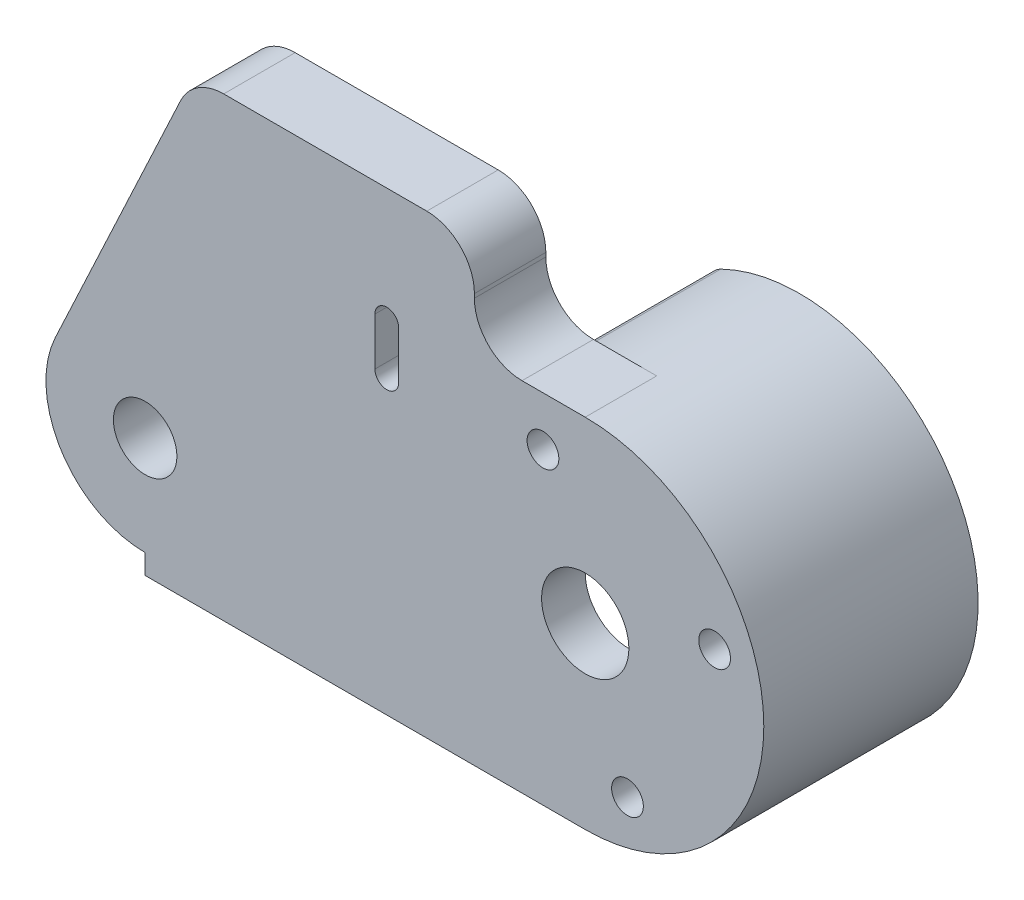
from build123d import *

# Parameters (mm, degrees)
SKETCH1_R               = 2
SKETCH1_R_2             = 5.5
SKETCH1_R_3             = 4
BOSS_EXTRUDE1_DEPTH     = 9
BOSS_EXTRUDE2_START     = -27
BOSS_EXTRUDE2_OUTLINE_R = 2
BOSS_EXTRUDE2_DEPTH     = 18
FILLET1_R               = 4
FILLET2_R               = 3
SKETCH3_R               = 11.25
CUT_EXTRUDE1_DEPTH      = 3.5
BOSS_EXTRUDE3_START     = -9
BOSS_EXTRUDE3_DEPTH     = 9
CUT_EXTRUDE2_DEPTH      = 93.793746104
CUT_EXTRUDE2_DEPTH_BACK = 93.793746104
SKETCH7_W               = 7.5
SKETCH7_H               = 5
CUT_EXTRUDE3_DEPTH      = 8.25
SKETCH8_R               = 2
CUT_EXTRUDE5_DEPTH      = 8.25
FILLET4_R               = 6


# Read off the part's stored shape, not the designer's step: Boss-Extrude2
with BuildPart() as part:
    # Sketch1 → Boss-Extrude1 (new body)
    with BuildSketch(Plane.XY):
        with BuildLine():
            Line((0, -15), (55.445040355, -15))
            ThreePointArc((55.445040355, -15), (77.945040355, 7.5), (55.445040355, 30))
            Line((55.445040355, 30), (12.958080577, 30))
            ThreePointArc((12.958080577, 30), (2.222427952, 26.874411477), (-5.157701411, 18.474576271))
            Line((-5.157701411, 18.474576271), (-11.322363742, 5.296610169))
            ThreePointArc((-11.322363742, 5.296610169), (-10.546507173, -6.709782891), (0, -12.5))
            Line((0, -12.5), (0, -15))
        make_face()
        with Locations((50.121730514, 23.802909935)):
            Circle(SKETCH1_R, mode=Mode.SUBTRACT)
        with Locations((60.768350196, -8.802909935)):
            Circle(SKETCH1_R, mode=Mode.SUBTRACT)
        with Locations((55.445040355, 7.5)):
            Circle(SKETCH1_R_2, mode=Mode.SUBTRACT)
        with Locations((71.74795029, 12.823309841)):
            Circle(SKETCH1_R, mode=Mode.SUBTRACT)
        Circle(SKETCH1_R_3, mode=Mode.SUBTRACT)
    extrude(amount=BOSS_EXTRUDE1_DEPTH)

    # Boss-Extrude2 outline → Boss-Extrude2 (add)
    with BuildSketch(Plane.XY.offset(9).offset(BOSS_EXTRUDE2_START)):
        with BuildLine():
            ThreePointArc((55.445040355, -15), (76.903671747, 14.265880489), (42.539570537, 25.930920997))
            Line((42.539570537, 25.930920997), (47.701758465, 18.558552598))
            ThreePointArc((47.701758465, 18.558552598), (68.32021919, 11.559528293), (55.445040355, -6))
            Line((55.445040355, -6), (55.445040355, -15))
        make_face()
        with Locations((60.768350196, -8.802909935)):
            Circle(BOSS_EXTRUDE2_OUTLINE_R, mode=Mode.SUBTRACT)
        with Locations((50.121730514, 23.802909935)):
            Circle(BOSS_EXTRUDE2_OUTLINE_R, mode=Mode.SUBTRACT)
        with Locations((71.74795029, 12.823309841)):
            Circle(BOSS_EXTRUDE2_OUTLINE_R, mode=Mode.SUBTRACT)
    extrude(amount=BOSS_EXTRUDE2_DEPTH)

    # Fillet1
    fillet1_edges = [part.edges().sort_by_distance(p)[0] for p in [
        (55.445040355, -6, -9),
        (55.445040355, -15, -9),
    ]]
    fillet(fillet1_edges, radius=FILLET1_R)

    # Fillet2
    fillet2_edges = [part.edges().sort_by_distance(p)[0] for p in [
        (47.701758465, 18.558552598, -9),
        (42.539570537, 25.930920997, -9),
    ]]
    fillet(fillet2_edges, radius=FILLET2_R)

    # Sketch3 → Cut-Extrude1 (cut)
    with BuildSketch(Plane(origin=(0, 0, 0), x_dir=(-1, 0, 0), z_dir=(0, 0, -1))):
        with Locations((-55.445040355, 7.5)):
            Circle(SKETCH3_R)
    extrude(amount=-CUT_EXTRUDE1_DEPTH, mode=Mode.SUBTRACT)

    # Sketch5 → Boss-Extrude3 (add)
    with BuildSketch(Plane.XY.offset(9).offset(BOSS_EXTRUDE3_START)):
        with BuildLine():
            Line((41.483809243, 30), (41.483809243, 42.5))
            Line((41.483809243, 42.5), (12.958080577, 42.5))
            Line((12.958080577, 42.5), (6.081409657, 42.5))
            Line((6.081409657, 42.5), (-5.157701411, 18.474576271))
            ThreePointArc((-5.157701411, 18.474576271), (2.222427952, 26.874411477), (12.958080577, 30))
            Line((12.958080577, 30), (41.483809243, 30))
        make_face()
    extrude(amount=BOSS_EXTRUDE3_DEPTH)

    # Sketch6 → Cut-Extrude2 (cut, two sides: drawn at the far end of the back side and taken through both)
    with BuildSketch(Plane.XY.offset(9).offset(-CUT_EXTRUDE2_DEPTH_BACK)):
        with BuildLine():
            Line((31.945040355, 28), (31.945040355, 22))
            ThreePointArc((31.945040355, 22), (30.445040355, 20.5), (28.945040355, 22))
            Line((28.945040355, 22), (28.945040355, 28))
            ThreePointArc((28.945040355, 28), (30.445040355, 29.5), (31.945040355, 28))
        make_face()
    extrude(amount=CUT_EXTRUDE2_DEPTH + CUT_EXTRUDE2_DEPTH_BACK, mode=Mode.SUBTRACT)

    # Sketch7 → Cut-Extrude3 (cut)
    with BuildSketch(Plane(origin=(0, 0, 0), x_dir=(-1, 0, 0), z_dir=(0, 0, -1))):
        with Locations((-27.75, -7.5)):
            Rectangle(SKETCH7_W, SKETCH7_H)
        with Locations((-12.75, -7.5)):
            Rectangle(SKETCH7_W, SKETCH7_H)
        with Locations((-42.75, -7.5)):
            Rectangle(SKETCH7_W, SKETCH7_H)
    extrude(amount=-CUT_EXTRUDE3_DEPTH, mode=Mode.SUBTRACT)

    # Sketch8 → Cut-Extrude5 (cut)
    with BuildSketch(Plane.XZ.offset(15)):
        with Locations((42.75, 4.5)):
            Circle(SKETCH8_R)
        with Locations((27.75, 4.5)):
            Circle(SKETCH8_R)
        with Locations((12.75, 4.5)):
            Circle(SKETCH8_R)
    extrude(amount=-CUT_EXTRUDE5_DEPTH, mode=Mode.SUBTRACT)

    # Fillet4
    fillet4_edges = [part.edges().sort_by_distance(p)[0] for p in [
        (41.483809243, 30, 4.5),
        (41.483809243, 42.5, 4.5),
        (6.081409657, 42.5, 4.5),
    ]]
    fillet(fillet4_edges, radius=FILLET4_R)


solid = part.part
